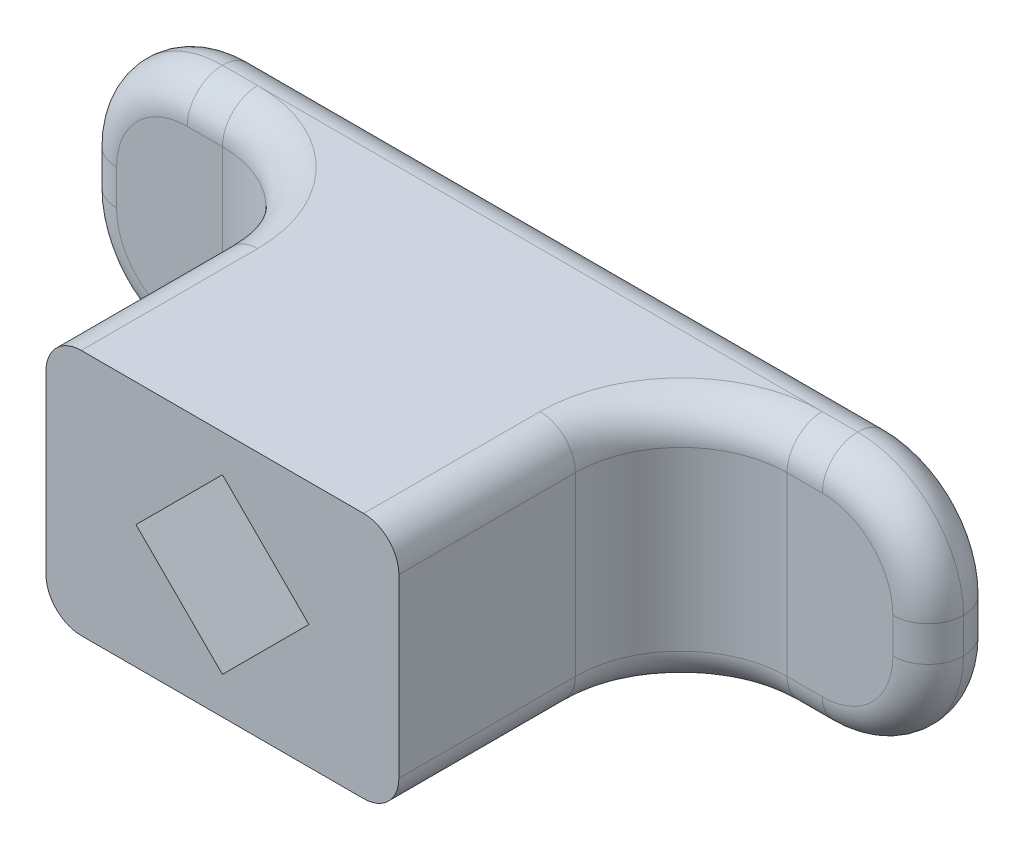
from build123d import *

# Parameters (mm, degrees)
BOSS_EXTRUDE1_DEPTH = 3.5
FILLET1_R           = 3
FILLET2_R           = 3
FILLET3_R           = 1
CUT_EXTRUDE1_DEPTH  = 4.5


with BuildPart() as part:
    # Sketch1 → Boss-Extrude1 (new, symmetric)
    with BuildSketch(Plane(origin=(0, 0, 0), x_dir=(1, 0, 0), z_dir=(0, 1, 0))):
        Polygon((5, 0), (-5, 0), (-5, 8), (-12, 8), (-12, 10), (12, 10), (12, 8), (5, 8), align=None)
    extrude(amount=BOSS_EXTRUDE1_DEPTH, both=True)

    # Fillet1
    fillet1_edges = [part.edges().sort_by_distance(p)[0] for p in [
        (12, 3.5, -9),
        (-12, 3.5, -9),
        (-12, -3.5, -9),
        (12, -3.5, -9),
    ]]
    fillet(fillet1_edges, radius=FILLET1_R)

    # Fillet2
    fillet2_edges = [part.edges().sort_by_distance(p)[0] for p in [
        (-5, 0, -8),
        (5, 0, -8),
    ]]
    fillet(fillet2_edges, radius=FILLET2_R)

    # Fillet3
    fillet3_edges = [part.edges().sort_by_distance(p)[0] for p in [
        (5, 3.5, -2.5),
        (5, -3.5, -2.5),
        (5.878679656, -3.5, -7.121320344),
        (11.121320344, -2.621320344, -8),
        (11.121320344, 2.621320344, -8),
        (-5, -3.5, -2.5),
        (-5.878679656, -3.5, -7.121320344),
        (-11.121320344, -2.621320344, -8),
        (-11.121320344, 2.621320344, -8),
        (-5, 3.5, -2.5),
        (5.878679656, 3.5, -7.121320344),
        (-5.878679656, 3.5, -7.121320344),
        (0, 3.5, -10),
        (-11.121320344, 2.621320344, -10),
        (-11.121320344, -2.621320344, -10),
        (0, -3.5, -10),
        (11.121320344, -2.621320344, -10),
        (11.121320344, 2.621320344, -10),
        (12, 0, -8),
        (-12, 0, -8),
        (12, 0, -10),
        (-12, 0, -10),
        (8.5, -3.5, -8),
        (8.5, 3.5, -8),
        (-8.5, -3.5, -8),
        (-8.5, 3.5, -8),
    ]]
    fillet(fillet3_edges, radius=FILLET3_R - 0.0001)  # a hair under: the kernel refuses the full size

    # Sketch3 → Cut-Extrude1 (cut)
    with BuildSketch(Plane.XY):
        Polygon((2.45, 0), (0, 2.45), (-2.45, 0), (0, -2.45), align=None)
    extrude(amount=-CUT_EXTRUDE1_DEPTH, mode=Mode.SUBTRACT)


solid = part.part
